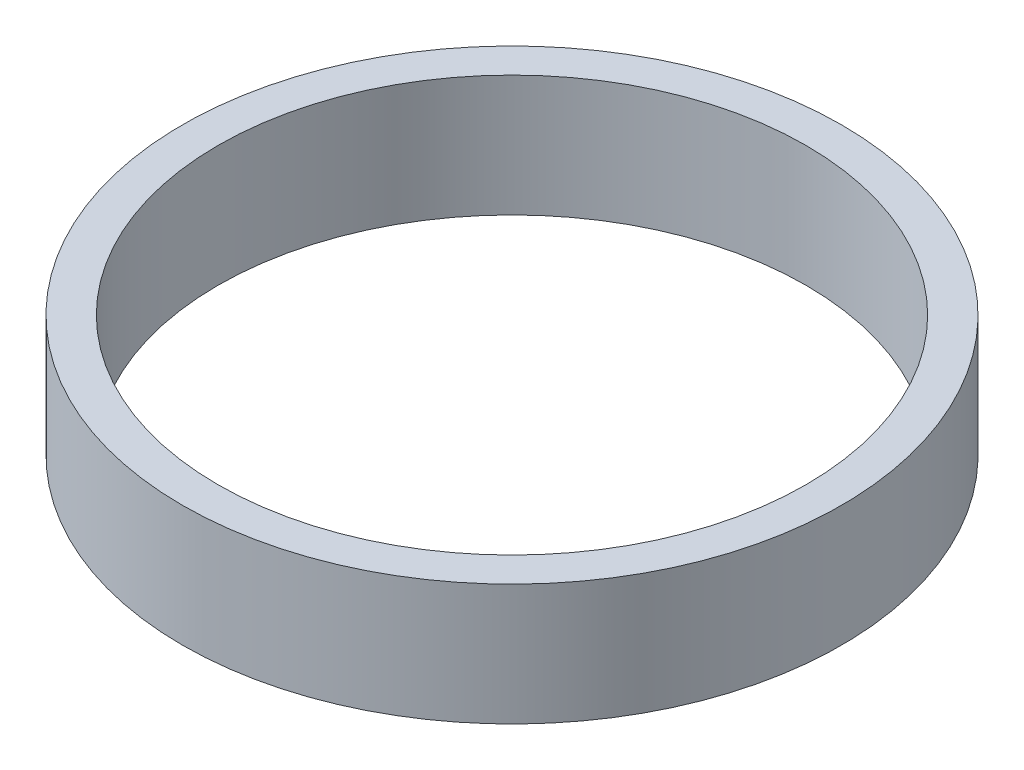
from build123d import *

# Parameters (mm, degrees)
SKETCH1_R           = 4.625
SKETCH1_R_2         = 4.125
BOSS_EXTRUDE1_DEPTH = 1.7


with BuildPart() as part:
    # Sketch1 → Boss-Extrude1 (new body)
    with BuildSketch(Plane(origin=(0, 0, 0), x_dir=(1, 0, 0), z_dir=(0, 1, 0))):
        Circle(SKETCH1_R)
        Circle(SKETCH1_R_2, mode=Mode.SUBTRACT)
    extrude(amount=BOSS_EXTRUDE1_DEPTH)


solid = part.part
